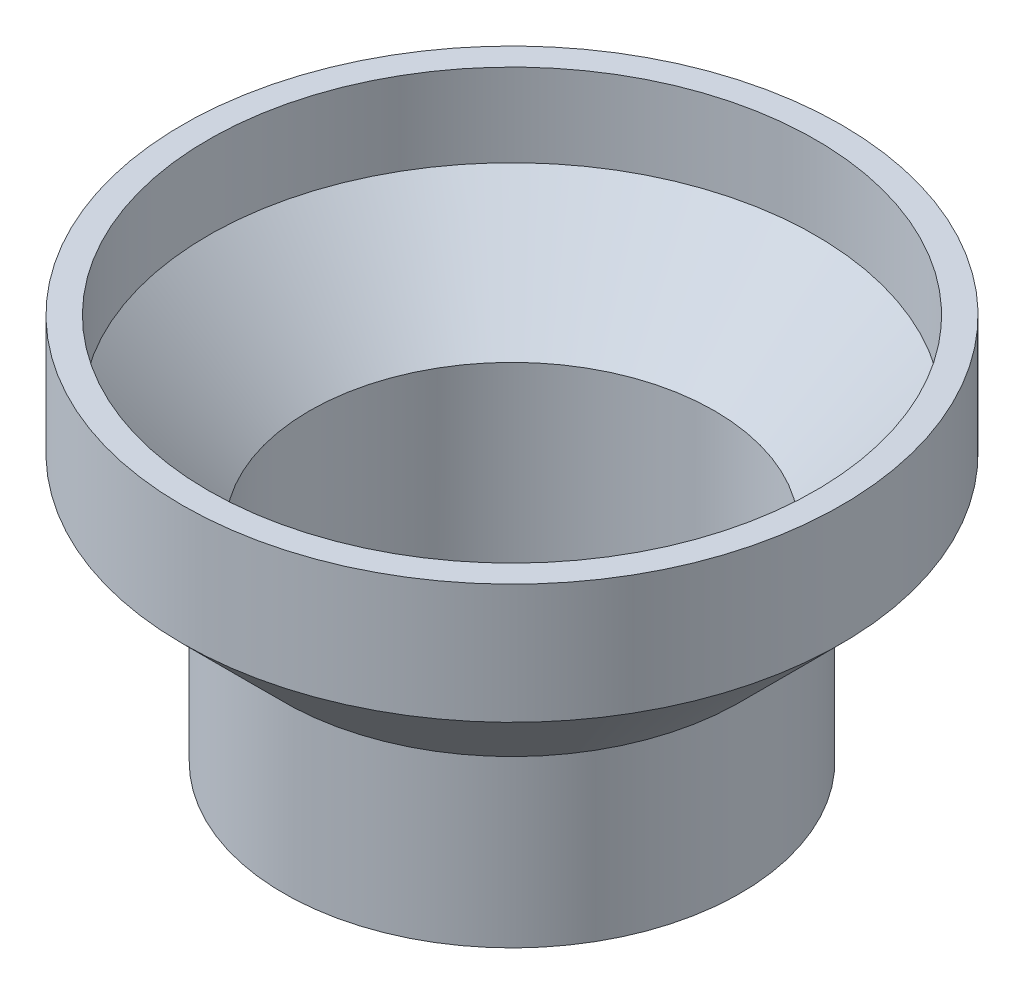
from build123d import *

# Parameters (mm, degrees)
SKETCH1_R           = 15.748
SKETCH1_R_2         = 13.97
BOSS_EXTRUDE1_DEPTH = 19.05
SKETCH2_R           = 22.733
SKETCH2_R_2         = 13.97
BOSS_EXTRUDE2_DEPTH = 7.62
SKETCH3_R           = 20.955
CUT_EXTRUDE1_DEPTH  = 5.08
CHAMFER1_SIZE       = 7.62
CHAMFER2_SIZE       = 7.62


with BuildPart() as part:
    # Sketch1 → Boss-Extrude1 (new body)
    with BuildSketch(Plane(origin=(0, 0, 0), x_dir=(1, 0, 0), z_dir=(0, 1, 0))):
        with Locations(Location((0, 0, 0), (0, 0, 90))):
            Circle(SKETCH1_R)
        with Locations(Location((0, 0, 0), (0, 0, 90))):
            Circle(SKETCH1_R_2, mode=Mode.SUBTRACT)
    extrude(amount=BOSS_EXTRUDE1_DEPTH)

    # Sketch2 → Boss-Extrude2 (add)
    with BuildSketch(Plane(origin=(0, 19.05, 0), x_dir=(1, 0, 0), z_dir=(0, 1, 0))):
        with Locations(Location((0, 0, 0), (0, 0, 90))):
            Circle(SKETCH2_R)
        with Locations(Location((0, 0, 0), (0, 0, 90))):
            Circle(SKETCH2_R_2, mode=Mode.SUBTRACT)
    extrude(amount=BOSS_EXTRUDE2_DEPTH)

    # Sketch3 → Cut-Extrude1 (cut)
    with BuildSketch(Plane(origin=(0, 26.67, 0), x_dir=(1, 0, 0), z_dir=(0, 1, 0))):
        with Locations(Location((0, 0, 0), (0, 0, 270))):
            Circle(SKETCH3_R)
    extrude(amount=-CUT_EXTRUDE1_DEPTH, mode=Mode.SUBTRACT)

    # Chamfer1
    # the kernel refuses this chamfer: 7.62 mm, written as the material it adds along each edge
    with BuildSketch(Plane(origin=(0, 19.05, 0), x_dir=(0, 0, -1), z_dir=(1, 0, 0))) as chamfer1_piece_1_section:
        Polygon((15.748, -CHAMFER1_SIZE), (15.748 + CHAMFER1_SIZE, 0), (15.748, 0), align=None)
    chamfer1_piece_1 = revolve(axis=Axis((0, 19.05, 0), (0, 1, 0)), mode=Mode.PRIVATE)
    chamfer1_piece_1 = chamfer1_piece_1 & Plane(origin=(0, 14.923095596, 0), x_dir=(0, 0, -1), z_dir=(0, -1, 0)) * Cylinder(22.733, 94, mode=Mode.PRIVATE)
    add(chamfer1_piece_1)

    # Chamfer2
    # the kernel refuses this chamfer: 7.62 mm, written as the material it takes off along each edge
    with BuildSketch(Plane(origin=(0, 21.59, 0), x_dir=(0, 0, -1), z_dir=(-1, 0, 0))) as chamfer2_piece_1_section:
        Polygon((13.97, CHAMFER2_SIZE), (13.97 + CHAMFER2_SIZE, 0), (13.97, 0), align=None)
    chamfer2_piece_1 = revolve(axis=Axis((0, 21.59, 0), (0, -1, 0)), mode=Mode.PRIVATE)
    chamfer2_piece_1 = chamfer2_piece_1 & Plane(origin=(0, 17.459443448, 0), x_dir=(0, 0, 1), z_dir=(0, 1, 0)) * Cylinder(20.955, 87, mode=Mode.PRIVATE)
    add(chamfer2_piece_1, mode=Mode.SUBTRACT)


solid = part.part
